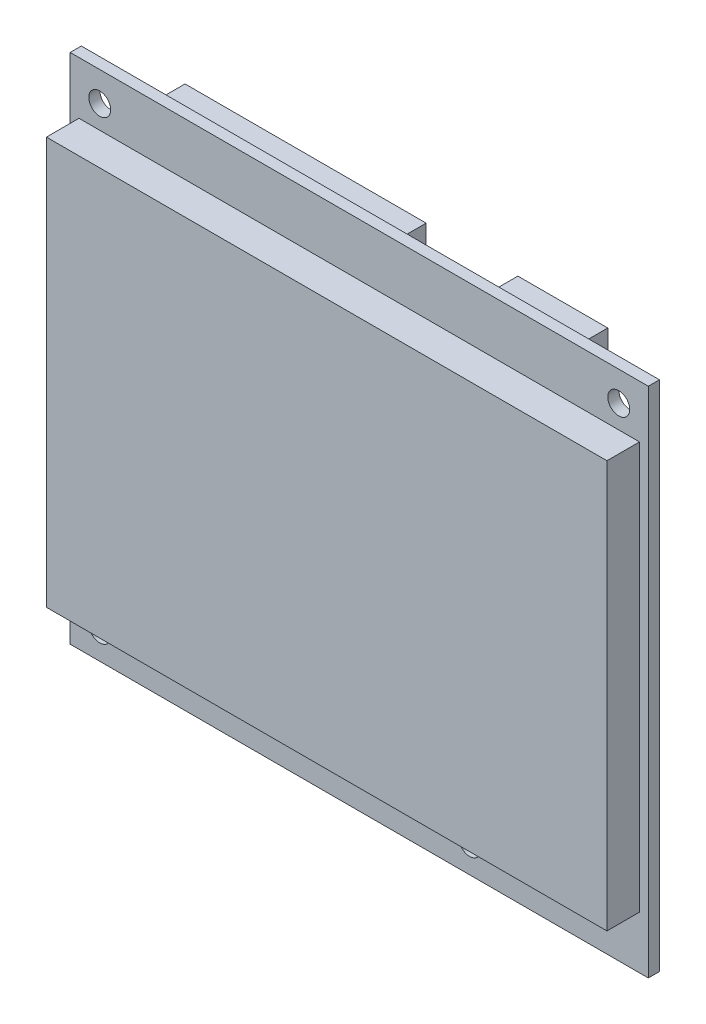
from build123d import *

# Parameters (mm, degrees)
SKETCH1_W           = 81.6864
SKETCH1_H           = 72.4154
BOSS_EXTRUDE1_DEPTH = 1.5748
SKETCH2_W           = 79.2
SKETCH2_H           = 57.54
BOSS_EXTRUDE2_DEPTH = 4.6
SKETCH4_R           = 1.55
CUT_EXTRUDE1_DEPTH  = 58.04256832
SKETCH3_W           = 12.7
SKETCH3_H           = 5.08
SKETCH3_W_2         = 34.071115987
BOSS_EXTRUDE3_DEPTH = 5.08
SKETCH5_W           = 11.143297124
SKETCH5_H           = 14.820585176
SKETCH5_W_2         = 5.702652661
SKETCH5_H_2         = 0.935331402
BOSS_EXTRUDE4_DEPTH = 1


with BuildPart() as part:
    # Sketch1 → Boss-Extrude1 (new body)
    with BuildSketch(Plane(origin=(0, 0, 0), x_dir=(-1, 0, 0), z_dir=(0, 0, -1))):
        with Locations((2.8, 0)):
            Rectangle(SKETCH1_W, SKETCH1_H)
    extrude(amount=BOSS_EXTRUDE1_DEPTH)

    # Sketch2 → Boss-Extrude2 (add)
    with BuildSketch(Plane(origin=(0, 0, 0), x_dir=(-1, 0, 0), z_dir=(0, 0, -1))):
        with Locations((2.8, 0)):
            Rectangle(SKETCH2_W, SKETCH2_H)
    extrude(amount=-BOSS_EXTRUDE2_DEPTH)

    # Sketch4 → Cut-Extrude1 (cut, through all)
    with BuildSketch(Plane(origin=(0, 0, -1.5748), x_dir=(-1, 0, 0), z_dir=(0, 0, -1))):
        with Locations((39.4682, 32.0327)):
            Circle(SKETCH4_R)
        with Locations((39.4682, -32.4077)):
            Circle(SKETCH4_R)
        with Locations((-12.7918, -32.4077)):
            Circle(SKETCH4_R)
        with Locations((-33.8682, 32.0327)):
            Circle(SKETCH4_R)
    extrude(amount=-CUT_EXTRUDE1_DEPTH, mode=Mode.SUBTRACT)

    # Sketch3 → Boss-Extrude3 (add)
    with BuildSketch(Plane.XY.offset(-1.5748)):
        with Locations((19.31004682, 31.274104804)):
            Rectangle(SKETCH3_W, SKETCH3_H)
        with Locations((-17.035557993, 31.274104804)):
            Rectangle(SKETCH3_W_2, SKETCH3_H)
        with Locations((-17.035557993, -31.699250815)):
            Rectangle(SKETCH3_W_2, SKETCH3_H)
    extrude(amount=-BOSS_EXTRUDE3_DEPTH)

    # Sketch5 → Boss-Extrude4 (add)
    with BuildSketch(Plane(origin=(0, 0, -1.5748), x_dir=(-1, 0, 0), z_dir=(0, 0, -1))):
        Polygon((19.476551601, 13.535617464), (30.731281697, 2.280887368), (19.476551601, -8.973842728), (8.221821505, 2.280887368), align=None)
        with Locations((-21.419348846, -17.387032057)):
            Rectangle(SKETCH5_W, SKETCH5_H)
        with Locations((-34.20974354, -34.592993391)):
            Rectangle(SKETCH5_W_2, SKETCH5_H_2)
    extrude(amount=BOSS_EXTRUDE4_DEPTH)


solid = part.part
